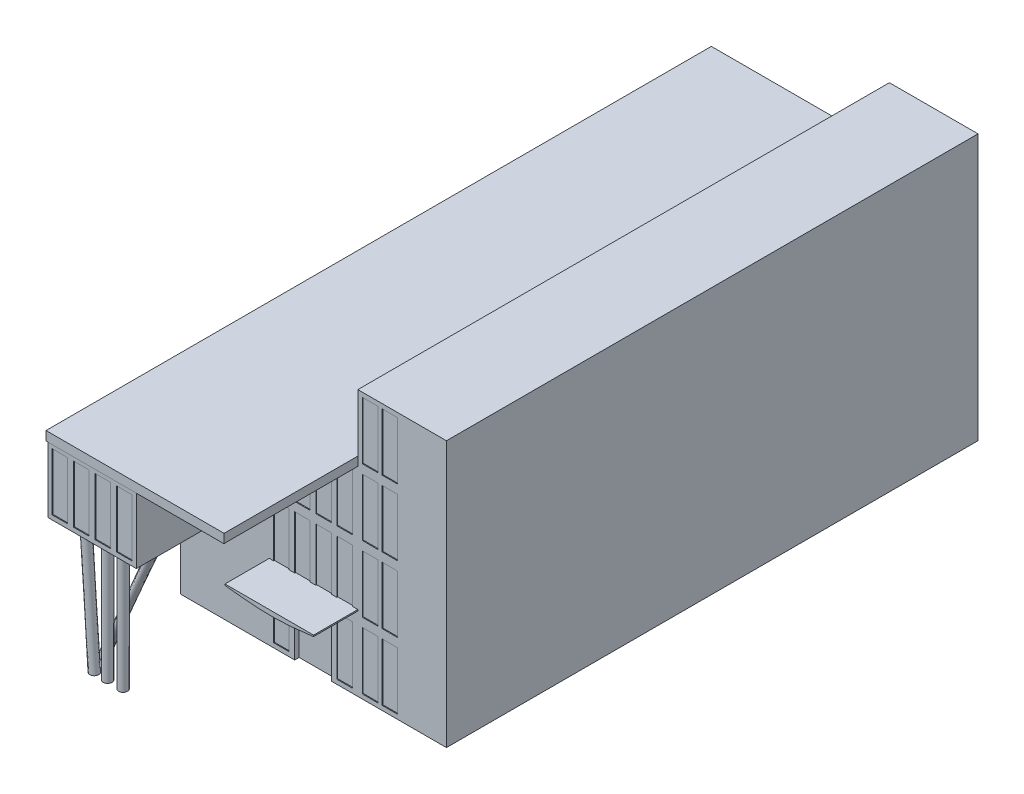
from build123d import *

# Parameters (mm, degrees)
SKETCH1_W                = 60
SKETCH1_H                = 120
BOSS_EXTRUDE1_DEPTH      = 60
SKETCH2_W                = 40
SKETCH2_H                = 120
CUT_EXTRUDE1_DEPTH       = 15
SKETCH3_W                = 20
SKETCH3_H                = 15
BOSS_EXTRUDE2_DEPTH      = 30
SKETCH4_W                = 40
SKETCH4_H                = 150
BOSS_EXTRUDE3_DEPTH      = 2
SKETCH6_W                = 3.5
SKETCH6_H                = 13
CUT_EXTRUDE2_DEPTH       = 0.2
SKETCH7_W                = 40
SKETCH7_H                = 2.051563456
BOSS_EXTRUDE5_DEPTH      = 0.2
SKETCH8_W                = 3.5
SKETCH8_H                = 12.948436544
CUT_EXTRUDE3_DEPTH       = 0.2
SKETCH9_W                = 3.5
SKETCH9_H                = 13
CUT_EXTRUDE4_DEPTH       = 0.2
BOSS_EXTRUDE6_DEPTH      = 10
BOSS_EXTRUDE6_DEPTH_BACK = 5
SKETCH5_W                = 20
SKETCH5_H                = 2
CUT_EXTRUDE6_DEPTH       = 10
SKETCH11_R               = 1
BOSS_EXTRUDE7_DEPTH      = 30
SKETCH16_W               = 8.25
SKETCH16_H               = 14
CUT_EXTRUDE10_DEPTH      = 1
SKETCH17_W               = 150.2
SKETCH17_H               = 2.051563456
BOSS_EXTRUDE8_DEPTH      = 0.2


with BuildPart() as part:
    # Sketch1 → Boss-Extrude1 (new body)
    with BuildSketch(Plane(origin=(0, 0, 0), x_dir=(1, 0, 0), z_dir=(0, 1, 0))):
        with Locations((30, 60)):
            Rectangle(SKETCH1_W, SKETCH1_H)
    extrude(amount=BOSS_EXTRUDE1_DEPTH)

    # Sketch2 → Cut-Extrude1 (cut)
    with BuildSketch(Plane(origin=(0, 60, 0), x_dir=(1, 0, 0), z_dir=(0, 1, 0))):
        with Locations((20, 60)):
            Rectangle(SKETCH2_W, SKETCH2_H)
    extrude(amount=-CUT_EXTRUDE1_DEPTH, mode=Mode.SUBTRACT)

    # Sketch3 → Boss-Extrude2 (add)
    with BuildSketch(Plane.XY):
        with Locations((10, 37.5)):
            Rectangle(SKETCH3_W, SKETCH3_H)
    extrude(amount=BOSS_EXTRUDE2_DEPTH)

    # Sketch4 → Boss-Extrude3 (add)
    with BuildSketch(Plane(origin=(0, 45, 0), x_dir=(1, 0, 0), z_dir=(0, 1, 0))):
        with Locations((20, 45)):
            Rectangle(SKETCH4_W, SKETCH4_H)
    extrude(amount=BOSS_EXTRUDE3_DEPTH)

    # Sketch6 → Cut-Extrude2 (cut)
    with BuildSketch(Plane.XY):
        with Locations((42.75, 52.5)):
            Rectangle(SKETCH6_W, SKETCH6_H)
        with Locations((47.25, 52.5)):
            Rectangle(SKETCH6_W, SKETCH6_H)
        with Locations((42.75, 37.5)):
            Rectangle(SKETCH6_W, SKETCH6_H)
        with Locations((47.25, 37.5)):
            Rectangle(SKETCH6_W, SKETCH6_H)
        with Locations((42.75, 22.5)):
            Rectangle(SKETCH6_W, SKETCH6_H)
        with Locations((47.25, 22.5)):
            Rectangle(SKETCH6_W, SKETCH6_H)
        with Locations((42.75, 7.5)):
            Rectangle(SKETCH6_W, SKETCH6_H)
        with Locations((47.25, 7.5)):
            Rectangle(SKETCH6_W, SKETCH6_H)
    extrude(amount=-CUT_EXTRUDE2_DEPTH, mode=Mode.SUBTRACT)

    # Sketch7 → Boss-Extrude5 (add)
    with BuildSketch(Plane.XY.offset(30)):
        with Locations((20, 45.974218272)):
            Rectangle(SKETCH7_W, SKETCH7_H)
    extrude(amount=BOSS_EXTRUDE5_DEPTH)

    # Sketch8 → Cut-Extrude3 (cut)
    with BuildSketch(Plane.XY.offset(30)):
        with Locations((2.75, 37.474218272)):
            Rectangle(SKETCH8_W, SKETCH8_H)
        with Locations((7.583333333, 37.474218272)):
            Rectangle(SKETCH8_W, SKETCH8_H)
        with Locations((12.416666667, 37.474218272)):
            Rectangle(SKETCH8_W, SKETCH8_H)
        with Locations((17.25, 37.474218272)):
            Rectangle(SKETCH8_W, SKETCH8_H)
    extrude(amount=-CUT_EXTRUDE3_DEPTH, mode=Mode.SUBTRACT)

    # Sketch9 → Cut-Extrude4 (cut)
    with BuildSketch(Plane.XY):
        with Locations((22.75, 37.5)):
            Rectangle(SKETCH9_W, SKETCH9_H)
        with Locations((27.5, 37.5)):
            Rectangle(SKETCH9_W, SKETCH9_H)
        with Locations((32.25, 37.5)):
            Rectangle(SKETCH9_W, SKETCH9_H)
        with Locations((37, 37.5)):
            Rectangle(SKETCH9_W, SKETCH9_H)
        with Locations((27.5, 22.5)):
            Rectangle(SKETCH9_W, SKETCH9_H)
        with Locations((32.25, 22.5)):
            Rectangle(SKETCH9_W, SKETCH9_H)
        with Locations((37, 22.5)):
            Rectangle(SKETCH9_W, SKETCH9_H)
        with Locations((27.5, 7.5)):
            Rectangle(SKETCH9_W, SKETCH9_H)
        with Locations((32.25, 7.5)):
            Rectangle(SKETCH9_W, SKETCH9_H)
        with Locations((37, 7.5)):
            Rectangle(SKETCH9_W, SKETCH9_H)
        with Locations((22.75, 22.5)):
            Rectangle(SKETCH9_W, SKETCH9_H)
        with Locations((22.75, 7.5)):
            Rectangle(SKETCH9_W, SKETCH9_H)
    extrude(amount=-CUT_EXTRUDE4_DEPTH, mode=Mode.SUBTRACT)

    # Sketch5 → Boss-Extrude6 (add, two sides: drawn at the far end of the back side and taken through both)
    with BuildSketch(Plane.XY.offset(-BOSS_EXTRUDE6_DEPTH_BACK)):
        with Locations((30, 16)):
            Rectangle(SKETCH5_W, SKETCH5_H)
    extrude(amount=BOSS_EXTRUDE6_DEPTH + BOSS_EXTRUDE6_DEPTH_BACK)

    # Sketch10 → Cut-Extrude6 (cut)
    with BuildSketch(Plane.XY.offset(10)):
        with BuildLine():
            Line((20, 16.7), (20, 14.90002652))
            Line((20, 14.90002652), (40, 15))
            Line((40, 15), (40, 16.7))
            add(Edge.make_bspline(
                [(20, 16.7), (29.09733539, 15.758398235), (31.486505864, 15.609879035), (40, 16.7)],
                knots=[0, 0, 0, 0, 1, 1, 1, 1], degree=3))
        make_face()
    extrude(amount=-CUT_EXTRUDE6_DEPTH, mode=Mode.SUBTRACT)

    # Sketch11 → Boss-Extrude7 (add)
    with BuildSketch(Plane(origin=(0, 30, 0), x_dir=(-1, 0, 0), z_dir=(0, -1, 0))):
        with Locations(Location((-8.5, -25, 0), (0, 0, 270))):
            Circle(SKETCH11_R)
        with Locations(Location((-12, -25, 0), (0, 0, 270))):
            Circle(SKETCH11_R)
    extrude(amount=BOSS_EXTRUDE7_DEPTH)

    # Boundary2: read off the stored shape, not the designer's step
    # Boundary2: loft between two sections, ruled curve by curve
    boundary2_from = [
        Edge.make_bspline([(4.204798324, 30, 25.709407727), (4.019075815, 30, 25.893923496), (3.495882591, 30, 26.110214391), (2.712993599, 30, 25.781419672), (2.391347556, 30, 24.99649345), (2.718236803, 30, 24.213124048), (3.503720437, 30, 23.891348254), (4.286533285, 30, 24.218104118), (4.610217643, 30, 25.003119773), (4.390520832, 30, 25.524891957), (4.204798324, 30, 25.709407727)], [0, 0, 0, 0, 0.125, 0.25, 0.375, 0.5, 0.625, 0.75, 0.875, 1, 1, 1, 1], 3),
    ]
    boundary2_to = [
        Edge.make_bspline([(5.766012578, 0, 25.963969558), (5.513645938, 0, 26.033611488), (4.951638215, 0, 25.965345689), (4.430818642, 0, 25.294698155), (4.535715543, 0, 24.452936912), (5.20493851, 0, 23.930763741), (6.047249113, 0, 24.035821103), (6.569002789, 0, 24.704654753), (6.465838055, 0, 25.547494109), (6.018379218, 0, 25.894327628), (5.766012578, 0, 25.963969558)], [0, 0, 0, 0, 0.125, 0.25, 0.375, 0.5, 0.625, 0.75, 0.875, 1, 1, 1, 1], 3),
    ]
    boundary2 = Solid(Shell([*[Face.make_surface_from_curves(boundary2_from[k], boundary2_to[k]) for k in range(1)], Face(Wire(boundary2_from)), Face(Wire(boundary2_to))]))
    add(boundary2)

    # Boundary3: read off the stored shape, not the designer's step
    # Boundary3: loft between two sections, ruled curve by curve
    boundary3_from = [
        Edge.make_bspline([(3.743086281, 0, 21.97000467), (3.99703291, 0, 21.906364831), (4.452587923, 0, 21.570236089), (4.575703736, 0, 20.730079176), (4.069951831, 0, 20.049064962), (3.230368388, 0, 19.924069587), (2.548955021, 0, 20.43023164), (2.424133085, 0, 21.26926968), (2.92890815, 0, 21.952075126), (3.489139652, 0, 22.03364451), (3.743086281, 0, 21.97000467)], [0, 0, 0, 0, 0.125, 0.25, 0.375, 0.5, 0.625, 0.75, 0.875, 1, 1, 1, 1], 3),
    ]
    boundary3_to = [
        Edge.make_bspline([(17.868163304, 30, 22.496278629), (17.998088745, 30, 22.268994008), (18.071017752, 30, 21.707572365), (17.550107266, 30, 21.036995444), (16.708568065, 30, 20.930331844), (16.03703216, 30, 21.449527114), (15.930388089, 30, 22.291638296), (16.449309955, 30, 22.962671415), (17.291465105, 30, 23.071280094), (17.738237863, 30, 22.723563251), (17.868163304, 30, 22.496278629)], [0, 0, 0, 0, 0.125, 0.25, 0.375, 0.5, 0.625, 0.75, 0.875, 1, 1, 1, 1], 3),
    ]
    boundary3 = Solid(Shell([*[Face.make_surface_from_curves(boundary3_from[k], boundary3_to[k]) for k in range(1)], Face(Wire(boundary3_from)), Face(Wire(boundary3_to))]))
    add(boundary3)

    # Sketch16 → Cut-Extrude10 (cut)
    with BuildSketch(Plane.XY):
        with Locations((29.875, 7)):
            Rectangle(SKETCH16_W, SKETCH16_H)
    extrude(amount=-CUT_EXTRUDE10_DEPTH, mode=Mode.SUBTRACT)

    # Sketch17 → Boss-Extrude8 (add)
    with BuildSketch(Plane.ZY):
        with Locations((-44.9, 45.974218272)):
            Rectangle(SKETCH17_W, SKETCH17_H)
    extrude(amount=BOSS_EXTRUDE8_DEPTH)


solid = part.part
